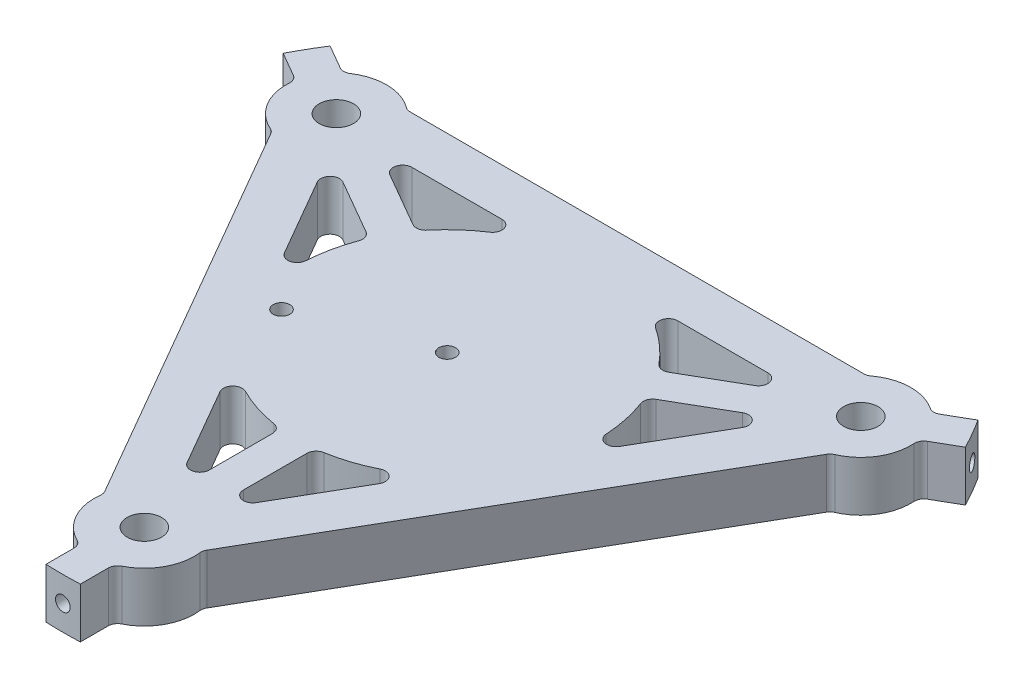
from build123d import *

# Parameters (mm, degrees)
SKETCH1_R               = 3.2639
SKETCH1_R_2             = 1.5875
BOSS_EXTRUDE1_DEPTH     = 4.7625
SKETCH3_R               = 1.397
CUT_EXTRUDE1_DEPTH      = 6.35
CIRPATTERN1_COUNT       = 3
CUT_EXTRUDE2_DEPTH      = 99.10069009
CUT_EXTRUDE2_DEPTH_BACK = 99.10069009
SKETCH4_R               = 1.5875


with BuildPart() as part:
    # Sketch1 → Boss-Extrude1 (new, symmetric)
    with BuildSketch(Plane(origin=(0, 0, 0), x_dir=(1, 0, 0), z_dir=(0, 1, 0))):
        with BuildLine():
            Line((-3.2639, -67.647177805), (-3.2639, -72.952022465))
            ThreePointArc((-3.2639, -72.952022465), (0, -73.025), (3.2639, -72.952022465))
            Line((3.2639, -72.952022465), (3.2639, -67.647177805))
            ThreePointArc((3.2639, -67.647177805), (3.530041907, -66.711459307), (4.248792135, -66.055868937))
            ThreePointArc((4.248792135, -66.055868937), (8.372836069, -62.072061677), (9.46261108, -56.442599084))
            ThreePointArc((9.46261108, -56.442599084), (9.488028557, -55.87828858), (9.68917198, -55.350430914))
            Line((9.68917198, -55.350430914), (52.779465272, 19.28414638))
            ThreePointArc((52.779465272, 19.28414638), (53.136031709, 19.722270528), (53.612030203, 20.026437961))
            ThreePointArc((53.612030203, 20.026437961), (57.942400312, 23.784942101), (59.330456636, 29.348372544))
            ThreePointArc((59.330456636, 29.348372544), (59.538839437, 30.298623685), (60.216124474, 30.996968587))
            Line((60.216124474, 30.996968587), (64.810254712, 33.649390917))
            ThreePointArc((64.810254712, 33.649390917), (63.241505111, 36.5125), (61.546354712, 39.302631548))
            Line((61.546354712, 39.302631548), (56.952224474, 36.650209218))
            ThreePointArc((56.952224474, 36.650209218), (56.00879753, 36.412835622), (55.081664501, 36.707496393))
            ThreePointArc((55.081664501, 36.707496393), (49.569564243, 38.287119576), (44.149419123, 36.416161123))
            ThreePointArc((44.149419123, 36.416161123), (43.648003152, 36.156018052), (43.090293292, 36.066284533))
            Line((43.090293292, 36.066284533), (-43.090293292, 36.066284533))
            ThreePointArc((-43.090293292, 36.066284533), (-43.648003152, 36.156018052), (-44.149419123, 36.416161123))
            ThreePointArc((-44.149419123, 36.416161123), (-49.569564243, 38.287119576), (-55.081664501, 36.707496393))
            ThreePointArc((-55.081664501, 36.707496393), (-56.00879753, 36.412835622), (-56.952224474, 36.650209218))
            Line((-56.952224474, 36.650209218), (-61.546354712, 39.302631548))
            ThreePointArc((-61.546354712, 39.302631548), (-63.241505111, 36.5125), (-64.810254712, 33.649390917))
            Line((-64.810254712, 33.649390917), (-60.216124474, 30.996968587))
            ThreePointArc((-60.216124474, 30.996968587), (-59.538839437, 30.298623685), (-59.330456636, 29.348372544))
            ThreePointArc((-59.330456636, 29.348372544), (-57.942400312, 23.784942101), (-53.612030203, 20.026437961))
            ThreePointArc((-53.612030203, 20.026437961), (-53.136031709, 19.722270528), (-52.779465272, 19.28414638))
            Line((-52.779465272, 19.28414638), (-9.68917198, -55.350430914))
            ThreePointArc((-9.68917198, -55.350430914), (-9.488028557, -55.87828858), (-9.46261108, -56.442599084))
            ThreePointArc((-9.46261108, -56.442599084), (-8.372836069, -62.072061677), (-4.248792135, -66.055868937))
            ThreePointArc((-4.248792135, -66.055868937), (-3.530041907, -66.711459307), (-3.2639, -67.647177805))
        make_face()
        with Locations((0, -57.531)):
            Circle(SKETCH1_R, mode=Mode.SUBTRACT)
        with Locations((-49.823307505, 28.7655)):
            Circle(SKETCH1_R, mode=Mode.SUBTRACT)
        with Locations((49.823307505, 28.7655)):
            Circle(SKETCH1_R, mode=Mode.SUBTRACT)
        Circle(SKETCH1_R_2, mode=Mode.SUBTRACT)
        with BuildLine():
            Line((3.2639, -41.947085229), (3.2639, -29.931318938))
            ThreePointArc((3.2639, -29.931318938), (3.684254787, -28.783240772), (4.746558577, -28.178019921))
            ThreePointArc((4.746558577, -28.178019921), (8.86834191, -27.164004432), (12.794439011, -25.550595989))
            ThreePointArc((12.794439011, -25.550595989), (14.884524009, -25.921032832), (15.130330606, -28.029410851))
            Line((15.130330606, -28.029410851), (6.581693168, -42.836085229))
            ThreePointArc((6.581693168, -42.836085229), (4.581719738, -43.664501348), (3.2639, -41.947085229))
        make_face(mode=Mode.SUBTRACT)
        with BuildLine():
            Line((-3.2639, -41.947085229), (-3.2639, -29.931318938))
            ThreePointArc((-3.2639, -29.931318938), (-3.684254787, -28.783240772), (-4.746558577, -28.178019921))
            ThreePointArc((-4.746558577, -28.178019921), (-8.86834191, -27.164004432), (-12.794439011, -25.550595989))
            ThreePointArc((-12.794439011, -25.550595989), (-14.884524009, -25.921032832), (-15.130330606, -28.029410851))
            Line((-15.130330606, -28.029410851), (-6.581693168, -42.836085229))
            ThreePointArc((-6.581693168, -42.836085229), (-4.581719738, -43.664501348), (-3.2639, -41.947085229))
        make_face(mode=Mode.SUBTRACT)
        with BuildLine():
            Line((-34.695291423, 23.80016293), (-24.289332569, 17.792279785))
            ThreePointArc((-24.289332569, 17.792279785), (-23.084890319, 17.582278626), (-22.029601791, 18.199650269))
            ThreePointArc((-22.029601791, 18.199650269), (-19.090546952, 21.262211599), (-15.730245703, 23.855607205))
            ThreePointArc((-15.730245703, 23.855607205), (-15.00601092, 25.850892331), (-16.709016547, 27.117956098))
            Line((-16.709016547, 27.117956098), (-33.806291423, 27.117956098))
            ThreePointArc((-33.806291423, 27.117956098), (-35.523707542, 25.80013636), (-34.695291423, 23.80016293))
        make_face(mode=Mode.SUBTRACT)
        with BuildLine():
            Line((-37.959191423, 18.146922299), (-27.553232569, 12.139039154))
            ThreePointArc((-27.553232569, 12.139039154), (-26.769145106, 11.200962147), (-26.776160369, 9.978369652))
            ThreePointArc((-26.776160369, 9.978369652), (-27.958888861, 5.901792833), (-28.524684714, 1.694988784))
            ThreePointArc((-28.524684714, 1.694988784), (-29.890534929, 0.070140501), (-31.839347153, 0.911454753))
            Line((-31.839347153, 0.911454753), (-40.387984591, 15.718129131))
            ThreePointArc((-40.387984591, 15.718129131), (-40.10542728, 17.864364988), (-37.959191423, 18.146922299))
        make_face(mode=Mode.SUBTRACT)
        with BuildLine():
            Line((37.959191423, 18.146922299), (27.553232569, 12.139039154))
            ThreePointArc((27.553232569, 12.139039154), (26.769145106, 11.200962147), (26.776160369, 9.978369652))
            ThreePointArc((26.776160369, 9.978369652), (27.958888861, 5.901792833), (28.524684714, 1.694988784))
            ThreePointArc((28.524684714, 1.694988784), (29.890534929, 0.070140501), (31.839347153, 0.911454753))
            Line((31.839347153, 0.911454753), (40.387984591, 15.718129131))
            ThreePointArc((40.387984591, 15.718129131), (40.10542728, 17.864364988), (37.959191423, 18.146922299))
        make_face(mode=Mode.SUBTRACT)
        with BuildLine():
            Line((34.695291423, 23.80016293), (24.289332569, 17.792279785))
            ThreePointArc((24.289332569, 17.792279785), (23.084890319, 17.582278626), (22.029601791, 18.199650269))
            ThreePointArc((22.029601791, 18.199650269), (19.090546952, 21.262211599), (15.730245703, 23.855607205))
            ThreePointArc((15.730245703, 23.855607205), (15.00601092, 25.850892331), (16.709016547, 27.117956098))
            Line((16.709016547, 27.117956098), (33.806291423, 27.117956098))
            ThreePointArc((33.806291423, 27.117956098), (35.523707542, 25.80013636), (34.695291423, 23.80016293))
        make_face(mode=Mode.SUBTRACT)
    extrude(amount=BOSS_EXTRUDE1_DEPTH, both=True)

    # Sketch3 → Cut-Extrude1 (cut)
    with BuildSketch(Plane.XY.offset(73.025)):
        Circle(SKETCH3_R)
    cut_extrude1 = extrude(amount=-CUT_EXTRUDE1_DEPTH, mode=Mode.SUBTRACT)

    # CirPattern1: Cut-Extrude1 ×3 about axis
    cirpattern1_axis = Axis((0, 4.7625, 0), (0, -1, 0))
    for i in range(1, CIRPATTERN1_COUNT):
        add(cut_extrude1.rotate(cirpattern1_axis, i * 360 / CIRPATTERN1_COUNT), mode=Mode.SUBTRACT)

    # Sketch4 → Cut-Extrude2 (cut, two sides: drawn at the far end of the back side and taken through both)
    with BuildSketch(Plane.XZ.offset(4.7625).offset(-CUT_EXTRUDE2_DEPTH_BACK)):
        with Locations((-22.820992584, 8.65138408)):
            Circle(SKETCH4_R)
    extrude(amount=CUT_EXTRUDE2_DEPTH + CUT_EXTRUDE2_DEPTH_BACK, mode=Mode.SUBTRACT)


solid = part.part
